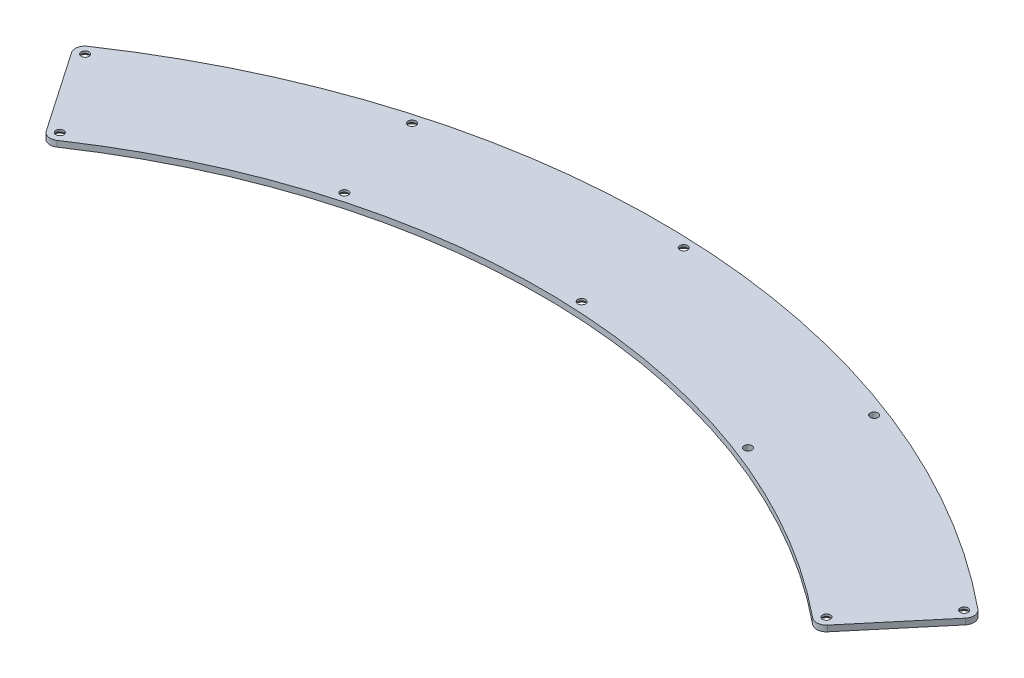
from build123d import *

# Parameters (mm, degrees)
SM_BASE_FLANGE_1_DEPTH = 3
CUT_EXTRUDE_1_DEPTH    = 10
FILLET_1_R             = 5
FILLET_2_R             = 5
SKETCH_3_R             = 2
CUT_EXTRUDE_2_DEPTH    = 10
SKETCH_5_R             = 2
CUT_EXTRUDE_4_DEPTH    = 10
CHAMFER_1_SIZE         = 1.9
SKETCH_6_R             = 2
CUT_EXTRUDE_5_DEPTH    = 10


# Sheet-metal steps are written as plain solids
with BuildPart() as part:
    # Sketch 1 → Базовая кромка1 (new body)
    with BuildSketch(Plane(origin=(0, 0, 0), x_dir=(1, 0, 0), z_dir=(0, 1, 0))):
        with BuildLine():
            Line((-218.547787293, 260.45511066), (-257.115043875, 306.417777248))
            ThreePointArc((-257.115043875, 306.417777248), (0, 400), (257.115043875, 306.417777248))
            Line((257.115043875, 306.417777248), (218.547787293, 260.45511066))
            ThreePointArc((218.547787293, 260.45511066), (0, 340), (-218.547787293, 260.45511066))
        make_face()
    extrude(amount=-SM_BASE_FLANGE_1_DEPTH)

    # Эскиз2 → Вырез-Вытянуть1 (cut)
    with BuildSketch(Plane(origin=(0, 0, 0), x_dir=(1, 0, 0), z_dir=(0, 1, 0))):
        Polygon((-185.870849123, 267.003439601), (-232.668944094, 335.207852497), (-262.024399195, 311.215696318), (-219.773904278, 254.720487984), align=None)
    extrude(amount=-CUT_EXTRUDE_1_DEPTH, mode=Mode.SUBTRACT)

    # Скругление1
    fillet_1_edges = [part.edges().sort_by_distance(p)[0] for p in [
        (-194.171567718, -1.5, -279.101061069),
        (-228.118354699, -1.5, -328.575738985),
    ]]
    fillet(fillet_1_edges, radius=FILLET_1_R)

    # Скругление2
    fillet_2_edges = [part.edges().sort_by_distance(p)[0] for p in [
        (257.115043875, -1.5, -306.417777248),
        (218.547787293, -1.5, -260.45511066),
    ]]
    fillet(fillet_2_edges, radius=FILLET_2_R)

    # Эскиз3 → Вырез-Вытянуть2 (cut)
    with BuildSketch(Plane(origin=(0, 0, 0), x_dir=(1, 0, 0), z_dir=(0, 1, 0))):
        with Locations(Location((-221.164496487, 327.278574755, 0), (0, 0, 270))):
            Circle(SKETCH_3_R)
        with Locations(Location((-192.875196767, 286.049223862, 0), (0, 0, 270))):
            Circle(SKETCH_3_R)
        with Locations(Location((217.908212497, 267.471514233, 0), (0, 0, 270))):
            Circle(SKETCH_3_R)
        with Locations(Location((250.050541416, 305.777250197, 0), (0, 0, 270))):
            Circle(SKETCH_3_R)
    extrude(amount=-CUT_EXTRUDE_2_DEPTH, mode=Mode.SUBTRACT)

    # Эскиз5 → Вырез-Вытянуть4 (cut)
    with BuildSketch(Plane(origin=(0, 0, 0), x_dir=(1, 0, 0), z_dir=(0, 1, 0))):
        with Locations(Location((15.5203425, 344.65072025, 0), (0, 0, 270))):
            Circle(SKETCH_5_R)
        with Locations(Location((17.7696675, 394.600099996, 0), (0, 0, 270))):
            Circle(SKETCH_5_R)
        with Locations(Location((-106.904799365, 380.258285738, 0), (0, 0, 270))):
            Circle(SKETCH_5_R)
        with Locations(Location((-93.372546281, 332.124325518, 0), (0, 0, 270))):
            Circle(SKETCH_5_R)
    extrude(amount=-CUT_EXTRUDE_4_DEPTH, mode=Mode.SUBTRACT)

    # Фаска1
    chamfer_1_edges = [part.edges().sort_by_distance(p)[0] for p in [
        (-93.372546281, -3, -334.124325518),
        (-221.164496487, -3, -329.278574755),
        (-192.875196767, -3, -288.049223862),
        (217.908212497, -3, -269.471514233),
        (250.050541416, -3, -307.777250197),
        (15.5203425, -3, -346.65072025),
        (17.7696675, -3, -396.600099996),
        (-106.904799365, -3, -382.258285738),
    ]]
    chamfer(chamfer_1_edges, length=CHAMFER_1_SIZE)

    # Эскиз6 → Вырез-Вытянуть5 (cut)
    with BuildSketch(Plane(origin=(0, 0, 0), x_dir=(1, 0, 0), z_dir=(0, 1, 0))):
        with Locations(Location((140.650436017, 369.110355921, 0), (0, 0, 270))):
            Circle(SKETCH_6_R)
        with Locations(Location((122.846583356, 322.387526058, 0), (0, 0, 270))):
            Circle(SKETCH_6_R)
    extrude(amount=-CUT_EXTRUDE_5_DEPTH, mode=Mode.SUBTRACT)


solid = part.part
